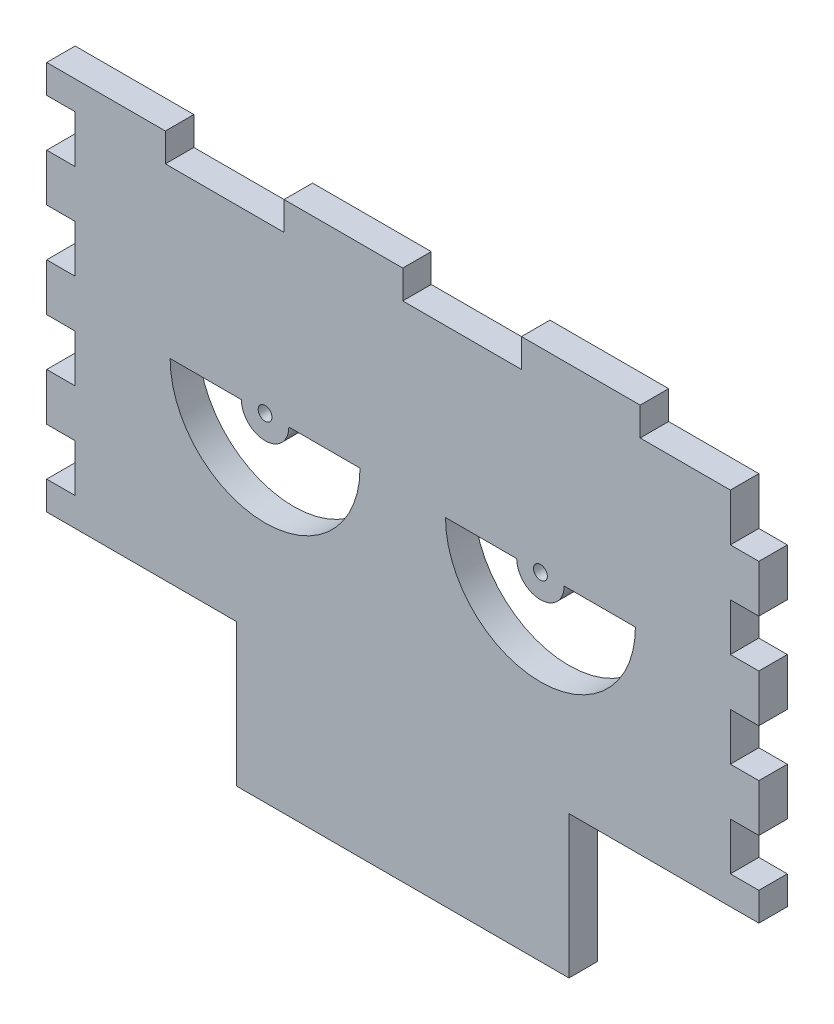
from build123d import *

# Parameters (mm, degrees)
BOSS_EXTRUDE1_DEPTH = 6
SKETCH2_W           = 6
SKETCH2_H           = 10
CUT_EXTRUDE1_DEPTH  = 10
SKETCH3_R           = 1.45
CUT_EXTRUDE2_DEPTH  = 6
SKETCH4_W           = 25
SKETCH4_H           = 6
CUT_EXTRUDE3_DEPTH  = 6


with BuildPart() as part:
    # Sketch1 → Boss-Extrude1 (new body)
    with BuildSketch(Plane.XY):
        Polygon((35, -41), (75, -41), (75, 41), (-75, 41), (-75, -41), (-35, -41), (-35, -71), (35, -71), align=None)
    extrude(amount=BOSS_EXTRUDE1_DEPTH)

    # Sketch2 → Cut-Extrude1 (cut)
    with BuildSketch(Plane.XY.offset(6)):
        with Locations((-72, 30)):
            Rectangle(SKETCH2_W, SKETCH2_H)
        with Locations((72, 30)):
            Rectangle(SKETCH2_W, SKETCH2_H)
        with Locations((72, 10)):
            Rectangle(SKETCH2_W, SKETCH2_H)
        with Locations((-72, 10)):
            Rectangle(SKETCH2_W, SKETCH2_H)
        with Locations((-72, -10)):
            Rectangle(SKETCH2_W, SKETCH2_H)
        with Locations((72, -10)):
            Rectangle(SKETCH2_W, SKETCH2_H)
        with Locations((-72, -30)):
            Rectangle(SKETCH2_W, SKETCH2_H)
        with Locations((72, -30)):
            Rectangle(SKETCH2_W, SKETCH2_H)
    extrude(amount=-CUT_EXTRUDE1_DEPTH, mode=Mode.SUBTRACT)

    # Sketch3 → Cut-Extrude2 (cut)
    with BuildSketch(Plane.XY.offset(6)):
        with Locations((-29, 0)):
            Circle(SKETCH3_R)
        with Locations((29, 0)):
            Circle(SKETCH3_R)
        with BuildLine():
            Line((-49, 0), (-34, 0))
            ThreePointArc((-34, 0), (-29, -5), (-24, 0))
            Line((-24, 0), (-9, 0))
            ThreePointArc((-9, 0), (-29, -20), (-49, 0))
        make_face()
        with BuildLine():
            Line((49, 0), (34, 0))
            ThreePointArc((34, 0), (29, -5), (24, 0))
            Line((24, 0), (9, 0))
            ThreePointArc((9, 0), (29, -20), (49, 0))
        make_face()
    extrude(amount=-CUT_EXTRUDE2_DEPTH, mode=Mode.SUBTRACT)

    # Sketch4 → Cut-Extrude3 (cut)
    with BuildSketch(Plane.XY.offset(6)):
        with Locations((12.5, 38)):
            Rectangle(SKETCH4_W, SKETCH4_H)
        with Locations((62.5, 38)):
            Rectangle(SKETCH4_W, SKETCH4_H)
        with Locations((-37.5, 38)):
            Rectangle(SKETCH4_W, SKETCH4_H)
    extrude(amount=-CUT_EXTRUDE3_DEPTH, mode=Mode.SUBTRACT)


solid = part.part
